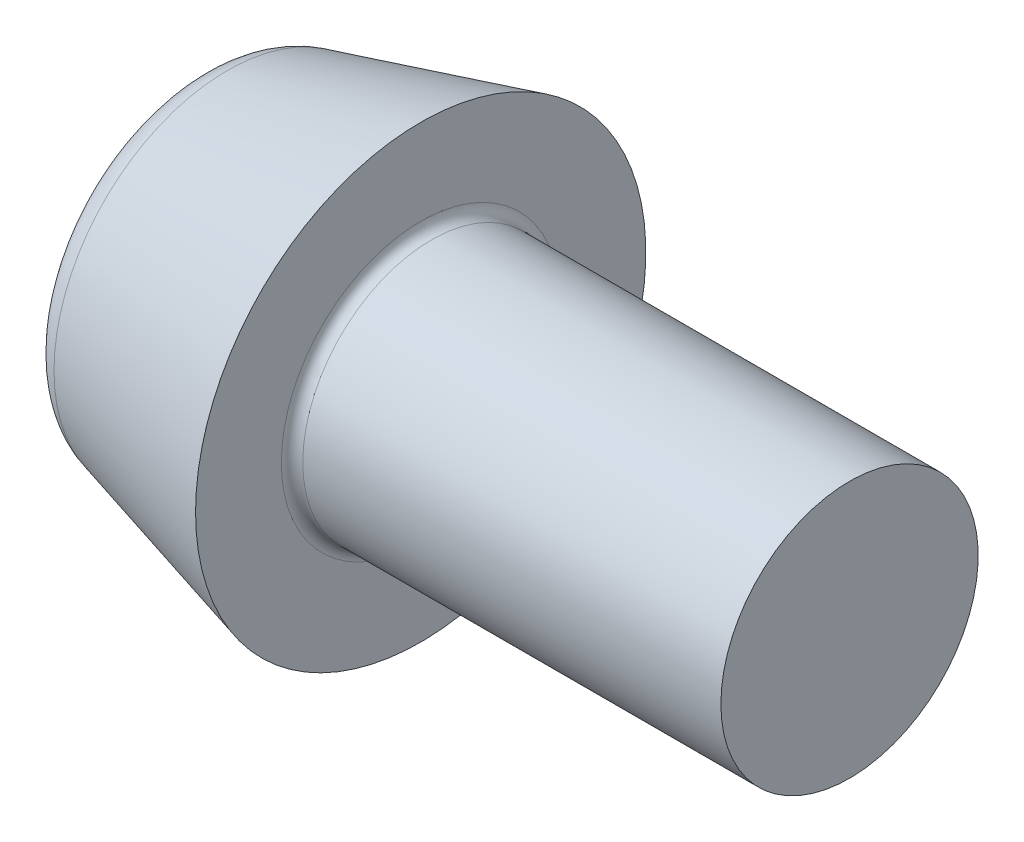
from build123d import *

# Parameters (mm, degrees)
FILLET1_R = 0.5
FILLET2_R = 2


with BuildPart() as part:
    # Sketch1 → Base-Revolve (revolve)
    with BuildSketch(Plane.XY):
        Polygon((0, 0), (30.5, 0), (30.5, 6), (10.5, 6), (10.5, 10.5), (0, 7.686533479), align=None)
    revolve(axis=Axis((-26.488571429, 0, 0), (1, 0, 0)))

    # Fillet1
    fillet1_edges = [part.edges().sort_by_distance(p)[0] for p in [
        (10.5, -6, 0),
    ]]
    fillet(fillet1_edges, radius=FILLET1_R)

    # Fillet2
    fillet2_edges = [part.edges().sort_by_distance(p)[0] for p in [
        (0, -7.686533479, 0),
    ]]
    fillet(fillet2_edges, radius=FILLET2_R)


solid = part.part
